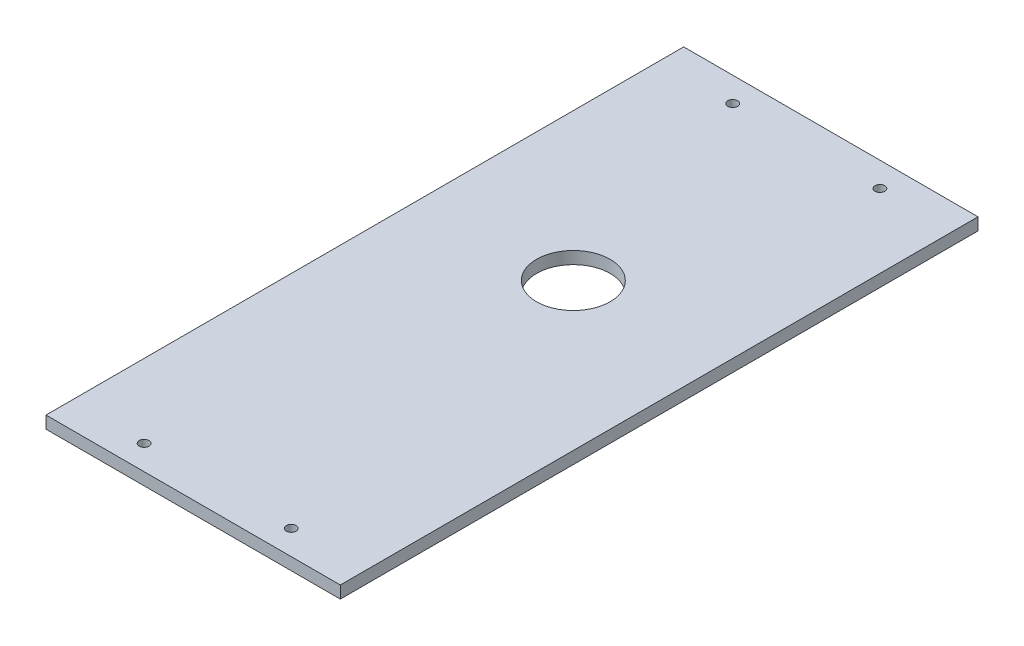
from build123d import *

# Parameters (mm, degrees)
SKETCH2_W           = 120
SKETCH2_H           = 260
BOSS_EXTRUDE1_DEPTH = 5
SKETCH3_R           = 15
CUT_EXTRUDE1_DEPTH  = 144.265487819
SKETCH5_R           = 2
CUT_EXTRUDE2_DEPTH  = 144.265487819


with BuildPart() as part:
    # Sketch2 → Boss-Extrude1 (new body)
    with BuildSketch(Plane(origin=(0, 0, 0), x_dir=(1, 0, 0), z_dir=(0, 1, 0))):
        Rectangle(SKETCH2_W, SKETCH2_H)
    extrude(amount=BOSS_EXTRUDE1_DEPTH)

    # Sketch3 → Cut-Extrude1 (cut, through all)
    with BuildSketch(Plane(origin=(0, 5, 0), x_dir=(1, 0, 0), z_dir=(0, 1, 0))):
        with Locations((0, 25)):
            Circle(SKETCH3_R)
    extrude(amount=-CUT_EXTRUDE1_DEPTH, mode=Mode.SUBTRACT)

    # Sketch5 → Cut-Extrude2 (cut, through all)
    with BuildSketch(Plane(origin=(0, 5, 0), x_dir=(1, 0, 0), z_dir=(0, 1, 0))):
        with Locations((-30, 120)):
            Circle(SKETCH5_R)
        with Locations((30, 120)):
            Circle(SKETCH5_R)
        with Locations((30, -120)):
            Circle(SKETCH5_R)
        with Locations((-30, -120)):
            Circle(SKETCH5_R)
    extrude(amount=-CUT_EXTRUDE2_DEPTH, mode=Mode.SUBTRACT)


solid = part.part
